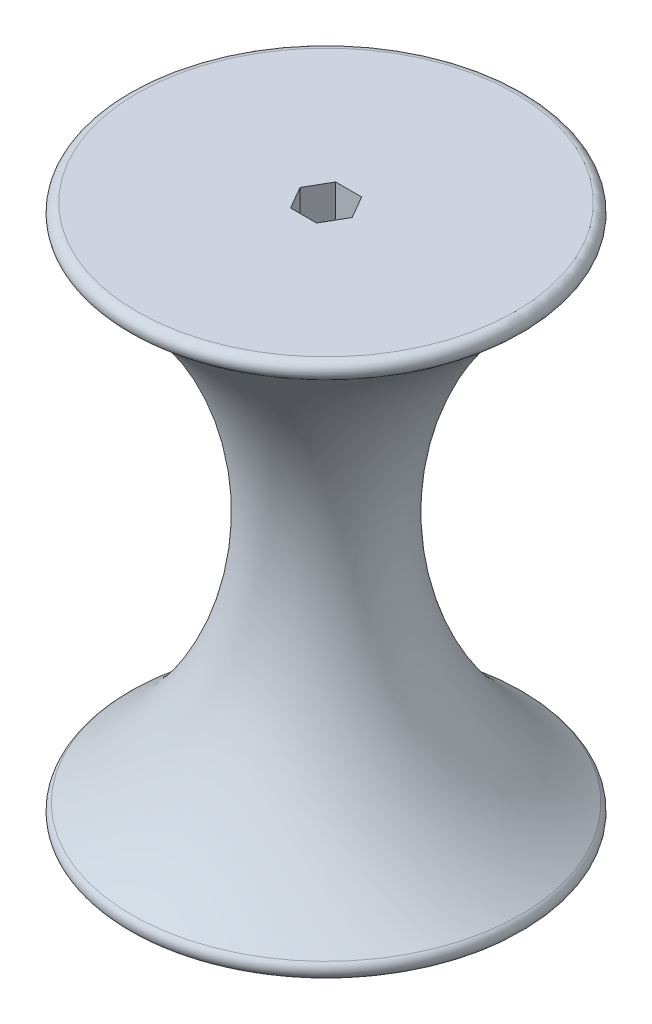
from build123d import *

# Parameters (mm, degrees)
CUT_EXTRUDE1_DEPTH = 172.951680952


with BuildPart() as part:
    # Sketch1 → Revolve1 (revolve)
    with BuildSketch(Plane.XY):
        with BuildLine():
            Line((0, -76.2), (53.76994832, -76.2))
            ThreePointArc((53.76994832, -76.2), (56.183319637, -74.451984147), (55.274949756, -71.613888889))
            ThreePointArc((55.274949756, -71.613888889), (19.05, 0), (55.274949756, 71.613888889))
            ThreePointArc((55.274949756, 71.613888889), (56.183319637, 74.451984147), (53.76994832, 76.2))
            Line((53.76994832, 76.2), (0, 76.2))
            Line((0, 76.2), (0, -76.2))
        make_face()
    revolve(axis=Axis((0, -76.2, 0), (0, 1, 0)))

    # Sketch3 → Cut-Extrude1 (cut, through all)
    with BuildSketch(Plane(origin=(0, 76.2, 0), x_dir=(1, 0, 0), z_dir=(0, 1, 0))):
        Polygon((7.405671903, 0), (3.702835951, -6.4135), (-3.702835951, -6.4135), (-7.405671903, 0), (-3.702835951, 6.4135), (3.702835951, 6.4135), align=None)
    extrude(amount=-CUT_EXTRUDE1_DEPTH, mode=Mode.SUBTRACT)


solid = part.part
